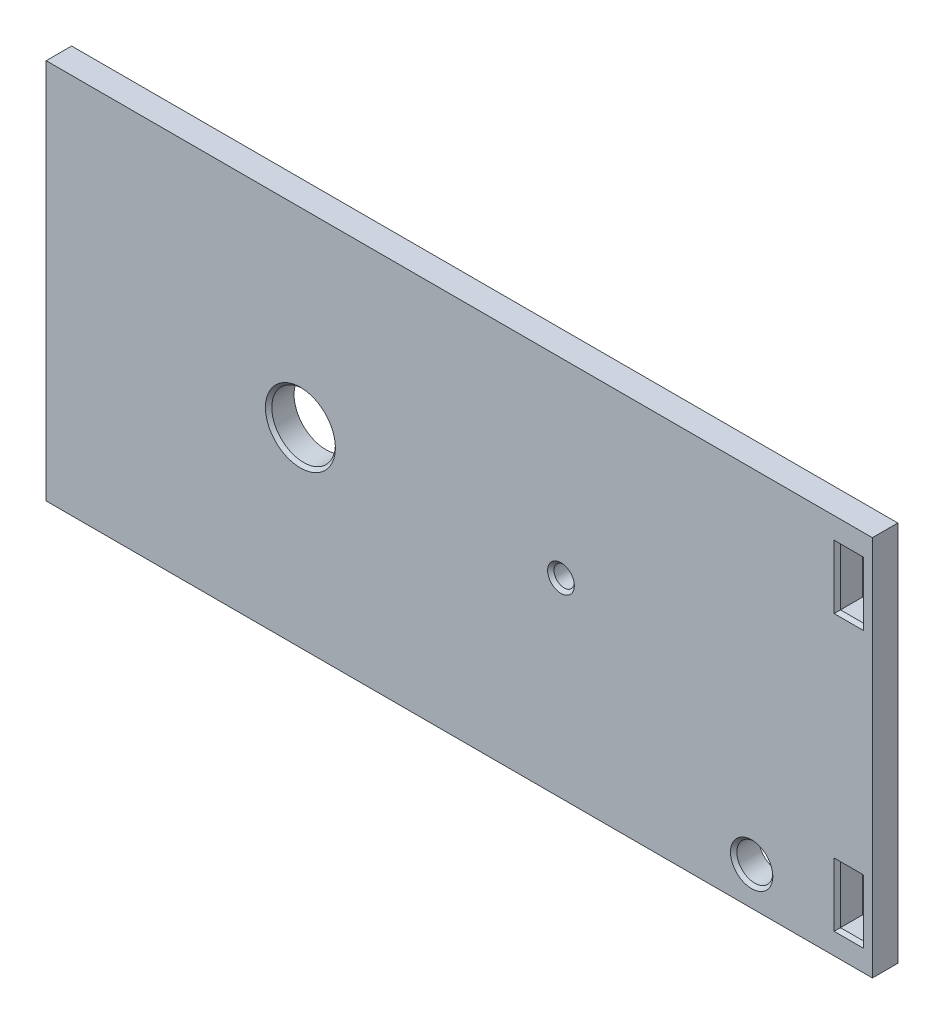
from build123d import *

# Parameters (mm, degrees)
SKETCH1_W           = 130
SKETCH1_H           = 60
SKETCH1_R           = 5
SKETCH1_R_2         = 2.83
SKETCH1_R_3         = 1.6
SKETCH1_W_2         = 3.65
SKETCH1_H_2         = 9
BOSS_EXTRUDE1_DEPTH = 2
CHAMFER1_SIZE       = 0.5


with BuildPart() as part:
    # Sketch1 → Boss-Extrude1 (new, symmetric)
    with BuildSketch(Plane.XY):
        Rectangle(SKETCH1_W, SKETCH1_H)
        with Locations((-25, 0)):
            Circle(SKETCH1_R, mode=Mode.SUBTRACT)
        with Locations((46, -24)):
            Circle(SKETCH1_R_2, mode=Mode.SUBTRACT)
        with Locations((16, 0)):
            Circle(SKETCH1_R_3, mode=Mode.SUBTRACT)
        with Locations((61.3, 21.65)):
            Rectangle(SKETCH1_W_2, SKETCH1_H_2, mode=Mode.SUBTRACT)
        with Locations((61.3, -21.65)):
            Rectangle(SKETCH1_W_2, SKETCH1_H_2, mode=Mode.SUBTRACT)
    extrude(amount=BOSS_EXTRUDE1_DEPTH, both=True)

    # Chamfer1
    chamfer1_edges = [part.edges().sort_by_distance(p)[0] for p in [
        (61.3, 17.15, 2),
        (59.475, 21.65, 2),
        (61.3, 26.15, 2),
        (63.125, 21.65, 2),
        (-30, 0, 2),
        (43.17, -24, 2),
        (61.3, -26.15, 2),
        (59.475, -21.65, 2),
        (61.3, -17.15, 2),
        (63.125, -21.65, 2),
        (14.4, 0, 2),
    ]]
    chamfer(chamfer1_edges, length=CHAMFER1_SIZE)


solid = part.part
